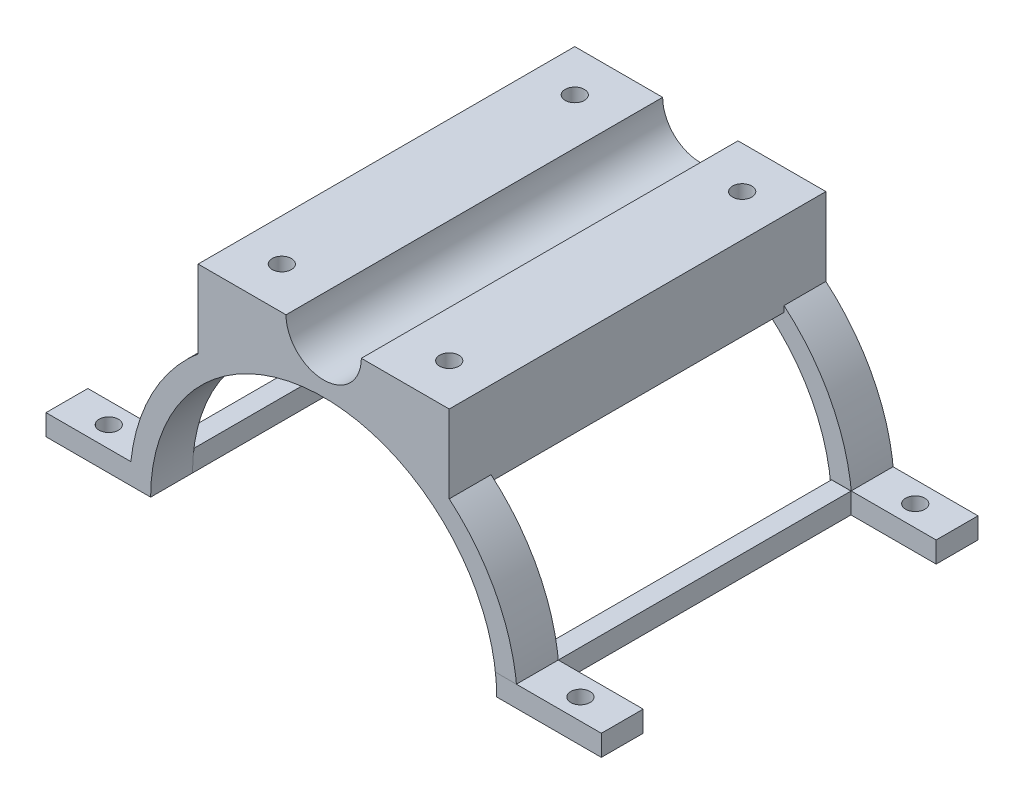
from build123d import *

# Parameters (mm, degrees)
BOSS_EXTRUDE1_DEPTH     = 10
SKETCH2_W               = 10
SKETCH2_H               = 5
BOSS_EXTRUDE2_DEPTH     = 66.35
SKETCH3_R               = 2.3
CUT_EXTRUDE1_DEPTH      = 132.7
SKETCH4_R               = 41.35
CUT_EXTRUDE3_DEPTH      = 50
LPATTERN4_START         = 80
LPATTERN4_DEPTH         = 10
LPATTERN4_2_DEPTH       = 10
LPATTERN4_3_DEPTH       = 10
MIRROR5_COPY_1_SKETCH_R = 2.3
MIRROR5_COPY_1_DEPTH    = 132.7
SKETCH8_W               = 4.648420871
SKETCH8_H               = 4.94728133
BOSS_EXTRUDE3_DEPTH     = 40
SKETCH11_W              = 60
SKETCH11_H              = 20
BOSS_EXTRUDE4_DEPTH     = 90
SKETCH12_R              = 41.35
CUT_EXTRUDE4_DEPTH      = 250
SKETCH13_R              = 9
CUT_EXTRUDE5_DEPTH      = 250
SKETCH14_R              = 2.3
CUT_EXTRUDE6_DEPTH      = 15
MIRROR8_COPY_1_SKETCH_R = 2.3
MIRROR8_COPY_1_DEPTH    = 15


# Read off the part's stored shape, not the designer's step: LPattern4
with BuildPart() as part:
    # Sketch1 → Boss-Extrude1 (new body)
    with BuildSketch(Plane.XY):
        with BuildLine():
            Line((-46.35, 0), (-41.35, 0))
            ThreePointArc((-41.35, 0), (0, 41.35), (41.35, 0))
            Line((41.35, 0), (46.35, 0))
            ThreePointArc((46.35, 0), (0, 46.35), (-46.35, 0))
        make_face()
    extrude(amount=BOSS_EXTRUDE1_DEPTH)



with BuildPart() as body_2:
    # Sketch2 → Boss-Extrude2 (new, symmetric)
    with BuildSketch(Plane(origin=(0, 0, 0), x_dir=(0, 0, -1), z_dir=(1, 0, 0))):
        with Locations((-5, 2.5)):
            Rectangle(SKETCH2_W, SKETCH2_H)
    extrude(amount=BOSS_EXTRUDE2_DEPTH, both=True)

    # Sketch3 → Cut-Extrude1 (cut)
    with BuildSketch(Plane(origin=(0, 5, 0), x_dir=(1, 0, 0), z_dir=(0, 1, 0))):
        with Locations(Location((56.35, -5, 0), (0, 0, 270))):
            Circle(SKETCH3_R)
    cut_extrude1 = extrude(amount=-CUT_EXTRUDE1_DEPTH, mode=Mode.SUBTRACT)

    # Mirror1: Cut-Extrude1 across plane
    add(cut_extrude1.mirror(Plane(origin=(0, 0, 0), x_dir=(0, 0, 1), z_dir=(1, 0, 0))), mode=Mode.SUBTRACT)

    # Sketch4 → Cut-Extrude3 (cut, symmetric)
    with BuildSketch(Plane.XY):
        Circle(SKETCH4_R)
    extrude(amount=CUT_EXTRUDE3_DEPTH, both=True, mode=Mode.SUBTRACT)


with BuildPart() as cut_extrude3_piece_1:
    # of the separate pieces the step leaves, piece 1, a body of its own (cut_extrude3_pieces)
    add(body_2.part.solids().sort_by_distance((-41.35, 0, 10))[0])


with BuildPart() as cut_extrude3_piece_2:
    # of the separate pieces the step leaves, piece 2, a body of its own (cut_extrude3_pieces)
    add(body_2.part.solids().sort_by_distance((66.35, 0, 10))[0])


with BuildPart() as body_4:
    # LPattern4 outline → LPattern4 (new body)
    with BuildSketch(Plane.XY.offset(LPATTERN4_START)):
        with BuildLine():
            Line((66.35, 0), (66.35, 5))
            Line((66.35, 5), (41.046589383, 5))
            ThreePointArc((41.046589383, 5), (41.274077646, 2.504598671), (41.35, 0))
            Line((41.35, 0), (66.35, 0))
        make_face()
    extrude(amount=LPATTERN4_DEPTH)

    # Mirror5: Cut-Extrude1 across plane
    add(cut_extrude1.mirror(Plane.XY.offset(45)), mode=Mode.SUBTRACT)


with BuildPart() as body_5:
    # LPattern4 2 outline → LPattern4 2 (new body)
    with BuildSketch(Plane.XY.offset(LPATTERN4_START)):
        with BuildLine():
            Line((-66.35, 0), (-41.35, 0))
            ThreePointArc((-41.35, 0), (-41.274077646, 2.504598671), (-41.046589383, 5))
            Line((-41.046589383, 5), (-66.35, 5))
            Line((-66.35, 5), (-66.35, 0))
        make_face()
    extrude(amount=LPATTERN4_2_DEPTH)

    # Mirror5 copy 1 sketch → Mirror5 copy 1 (cut)
    with BuildSketch(Plane(origin=(0, 5, 90), x_dir=(-1, 0, 0), z_dir=(0, 1, 0))):
        with Locations(Location((56.35, -5, 0), (0, 0, 270))):
            Circle(MIRROR5_COPY_1_SKETCH_R)
    extrude(amount=-MIRROR5_COPY_1_DEPTH, mode=Mode.SUBTRACT)


with BuildPart() as body_6:
    # LPattern4 3 outline → LPattern4 3 (new body)
    with BuildSketch(Plane.XY.offset(LPATTERN4_START)):
        with BuildLine():
            Line((-46.35, 0), (-41.35, 0))
            ThreePointArc((-41.35, 0), (0, 41.35), (41.35, 0))
            Line((41.35, 0), (46.35, 0))
            ThreePointArc((46.35, 0), (0, 46.35), (-46.35, 0))
        make_face()
    extrude(amount=LPATTERN4_3_DEPTH)


with BuildPart() as part_1:
    add(part.part)

    add(cut_extrude3_piece_1.part)  # Boss-Extrude3 merges Cut-Extrude3 piece 1

    add(body_5.part)  # Boss-Extrude3 merges body 5

    add(body_6.part)  # Boss-Extrude3 merges body 6
    # Sketch8 → Boss-Extrude3 (add, symmetric)
    with BuildSketch(Plane.XY.offset(45)):
        with Locations((-43.674210436, 2.473640665)):
            Rectangle(SKETCH8_W, SKETCH8_H)
    boss_extrude3 = extrude(amount=BOSS_EXTRUDE3_DEPTH, both=True)

    # Mirror6: Boss-Extrude3 across plane
    add(boss_extrude3.mirror(Plane(origin=(0, 0, 0), x_dir=(0, 0, 1), z_dir=(1, 0, 0))))

    # Sketch11 → Boss-Extrude4 (add)
    with BuildSketch(Plane.XY.offset(90)):
        with Locations((0, 43.923251299)):
            Rectangle(SKETCH11_W, SKETCH11_H)
    extrude(amount=-BOSS_EXTRUDE4_DEPTH)

    # Sketch12 → Cut-Extrude4 (cut, symmetric)
    with BuildSketch(Plane.XY.offset(90)):
        Circle(SKETCH12_R)
    extrude(amount=CUT_EXTRUDE4_DEPTH, both=True, mode=Mode.SUBTRACT)

    # Sketch13 → Cut-Extrude5 (cut, symmetric)
    with BuildSketch(Plane.XY.offset(90)):
        with Locations((0, 53.923251299)):
            Circle(SKETCH13_R)
    extrude(amount=CUT_EXTRUDE5_DEPTH, both=True, mode=Mode.SUBTRACT)

    # Sketch14 → Cut-Extrude6 (cut, symmetric)
    with BuildSketch(Plane(origin=(0, 53.923251299, 0), x_dir=(1, 0, 0), z_dir=(0, 1, 0))):
        with Locations(Location((20, -80, 0), (0, 0, 270))):
            Circle(SKETCH14_R)
    cut_extrude6 = extrude(amount=CUT_EXTRUDE6_DEPTH, both=True, mode=Mode.SUBTRACT)

    # Mirror7: Cut-Extrude6 across plane
    add(cut_extrude6.mirror(Plane(origin=(0, 0, 0), x_dir=(0, 0, 1), z_dir=(1, 0, 0))), mode=Mode.SUBTRACT)

    # Mirror8: Cut-Extrude6 across plane
    add(cut_extrude6.mirror(Plane.XY.offset(45)), mode=Mode.SUBTRACT)

    # Mirror8 copy 1 sketch → Mirror8 copy 1 (cut, symmetric)
    with BuildSketch(Plane(origin=(0, 53.923251299, 90), x_dir=(-1, 0, 0), z_dir=(0, 1, 0))):
        with Locations(Location((20, -80, 0), (0, 0, 270))):
            Circle(MIRROR8_COPY_1_SKETCH_R)
    extrude(amount=MIRROR8_COPY_1_DEPTH, both=True, mode=Mode.SUBTRACT)


solid = Compound([cut_extrude3_piece_2.part, body_4.part, part_1.part])
